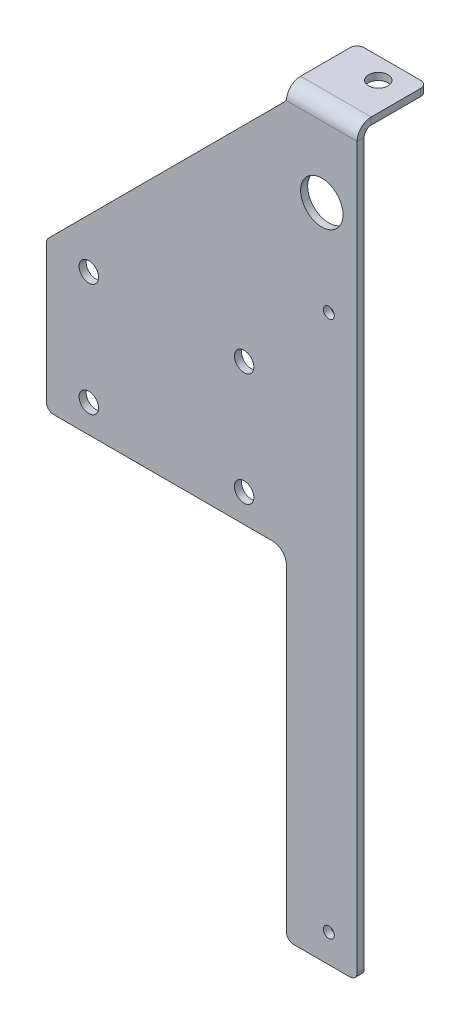
from build123d import *

# Parameters (mm, degrees)
BASE_FLANGE1_DEPTH  = 31.75
SKETCH6_R           = 4.3688
CUT_EXTRUDE1_DEPTH  = 337.385219094
SKETCH7_R           = 2.4511
SKETCH7_R_2         = 9.525
CUT_EXTRUDE2_DEPTH  = 337.385219094
SKETCH8_R           = 4.3688
BOSS_EXTRUDE1_DEPTH = 3.175
FILLET1_R           = 6.35
FILLET2_R           = 3.175


# Sheet-metal steps are written as plain solids
with BuildPart() as part:
    # Sketch1 → Base-Flange1 (new body)
    with BuildSketch(Plane(origin=(0, 0, 0), x_dir=(0, 0, -1), z_dir=(1, 0, 0))):
        with BuildLine():
            Line((31.75, 0), (6.35, 0))
            ThreePointArc((6.35, 0), (1.859871939, -1.859871939), (0, -6.35))
            Line((0, -6.35), (0, -333.375))
            Line((0, -333.375), (3.175, -333.375))
            Line((3.175, -333.375), (3.175, -6.35))
            ThreePointArc((3.175, -6.35), (4.10493597, -4.10493597), (6.35, -3.175))
            Line((6.35, -3.175), (31.75, -3.175))
            Line((31.75, -3.175), (31.75, 0))
        make_face()
    extrude(amount=BASE_FLANGE1_DEPTH)

    # Sketch6 → Cut-Extrude1 (cut, through all)
    with BuildSketch(Plane(origin=(0, 0, 0), x_dir=(1, 0, 0), z_dir=(0, 1, 0))):
        with Locations(Location((19.05, 22.225, 0), (0, 0, 270))):
            Circle(SKETCH6_R)
    extrude(amount=-CUT_EXTRUDE1_DEPTH, mode=Mode.SUBTRACT)

    # Sketch7 → Cut-Extrude2 (cut, through all)
    with BuildSketch(Plane.XY):
        with Locations((19.05, -79.375)):
            Circle(SKETCH7_R)
        with Locations((19.05, -320.675)):
            Circle(SKETCH7_R)
        with Locations((15.875, -38.1)):
            Circle(SKETCH7_R_2)
    extrude(amount=-CUT_EXTRUDE2_DEPTH, mode=Mode.SUBTRACT)

    # Sketch8 → Boss-Extrude1 (add)
    with BuildSketch(Plane.XY):
        Polygon((-107.95, -180.975), (-107.95, -114.3), (0, -6.35), (0, -180.975), align=None)
        with Locations((-88.9, -117.475)):
            Circle(SKETCH8_R, mode=Mode.SUBTRACT)
        with Locations((-19.05, -117.475)):
            Circle(SKETCH8_R, mode=Mode.SUBTRACT)
        with Locations((-88.9, -168.275)):
            Circle(SKETCH8_R, mode=Mode.SUBTRACT)
        with Locations((-19.05, -168.275)):
            Circle(SKETCH8_R, mode=Mode.SUBTRACT)
    extrude(amount=-BOSS_EXTRUDE1_DEPTH)

    # Fillet1
    fillet1_edges = [part.edges().sort_by_distance(p)[0] for p in [
        (0, -180.975, -1.5875),
    ]]
    fillet(fillet1_edges, radius=FILLET1_R)

    # Fillet2
    fillet2_edges = [part.edges().sort_by_distance(p)[0] for p in [
        (0, -6.35, -1.5875),
        (31.75, -1.5875, -31.75),
        (-107.95, -180.975, -1.5875),
        (-107.95, -114.3, -1.5875),
        (0, -1.5875, -31.75),
        (31.75, -333.375, -1.5875),
        (0, -333.375, -1.5875),
    ]]
    fillet(fillet2_edges, radius=FILLET2_R)


solid = part.part
